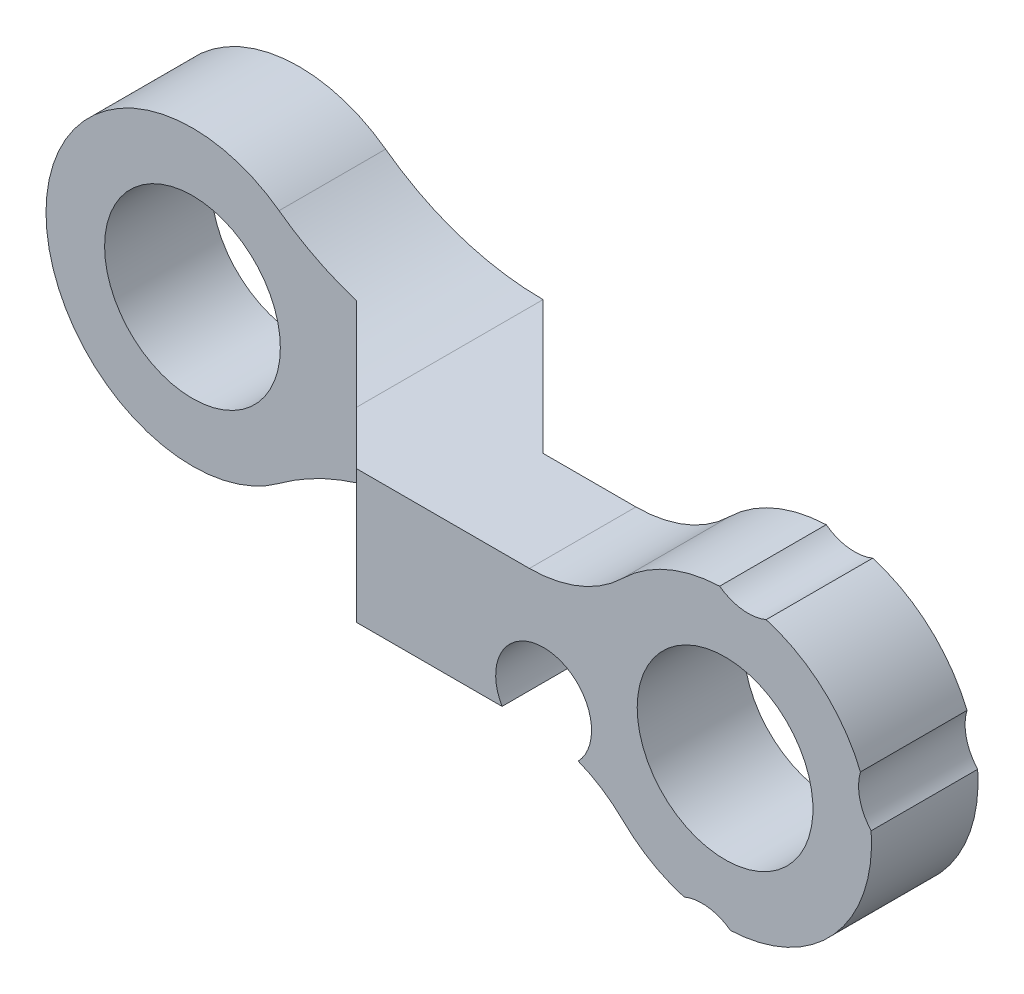
from build123d import *

# Parameters (mm, degrees)
SKETCH_1_R          = 2
EXTRUDE_1_DEPTH     = 4
FILLET_1_R          = 10
FILLET_2_R          = 2
SKETCH_8_R          = 3.300000000000001
EXTRUDE_3_DEPTH     = 5
CHAMFER_1_SIZE      = 5
SKETCH_9_R          = 3.300000000000001
CUT_EXTRUDE_3_DEPTH = 5
CHAMFER_2_SIZE      = 5
SKETCH_10_R         = 5.5
SKETCH_10_R_2       = 3.3000000000000003
EXTRUDE_4_DEPTH     = 4
SKETCH_11_R         = 3.3000000000000007
CUT_EXTRUDE_4_DEPTH = 4
FILLET_3_R          = 5
SKETCH_12_R         = 1.7999999999999998
SKETCH_12_R_2       = 1.800000000000001
SKETCH_12_R_3       = 1.7999999999999972
SKETCH_12_R_4       = 1.8000000000000007
CUT_EXTRUDE_5_DEPTH = 10


with BuildPart() as part:
    # ｽｹｯﾁ1 → ﾎﾞｽ - 押し出し1 (new body)
    # profile 1 of 5: a face of its own
    with BuildSketch(Plane.XY):
        with BuildLine():
            ThreePointArc((-27.5, 2.1540659228538024), (-27.33345237791561, 2.333452377915602), (-27.15406592285381, 2.49999999999999))
            Line((-27.154065922853814, 2.499999999999997), (-27.499999999999996, 2.499999999999997))
            Line((-27.499999999999996, 2.499999999999997), (-27.499999999999996, 2.154065922853802))
        make_face()
    # profile 2 of 5: a face of its own
    with BuildSketch(Plane.XY):
        with BuildLine():
            Line((-27.5, -2.500000000000003), (-27.154065922853817, -2.500000000000003))
            ThreePointArc((-27.154065922853817, -2.499999999999992), (-27.333452377915613, -2.3334523779156044), (-27.5, -2.1540659228538055))
            Line((-27.5, -2.1540659228538055), (-27.5, -2.500000000000003))
        make_face()
    # profile 3 of 5: a face of its own
    with BuildSketch(Plane.XY):
        with BuildLine():
            ThreePointArc((-20.10102051443362, 2.49999999999994), (-30.499999999999996, -2.39e-15), (-20.101020514433618, -2.4999999999999454))
            Line((-20.1010205144336, -2.500000000000002), (-22.84593407714621, -2.5000000000000027))
            ThreePointArc((-22.845934077146207, -2.5000000000000133), (-25.000000000000018, -3.3000000000000043), (-27.154065922853817, -2.499999999999992))
            Line((-27.154065922853817, -2.500000000000003), (-27.5, -2.500000000000003))
            Line((-27.5, -2.500000000000003), (-27.5, -2.1540659228538055))
            ThreePointArc((-27.5, -2.1540659228538055), (-28.3, -1.19e-15), (-27.5, 2.1540659228538024))
            Line((-27.499999999999996, 2.154065922853802), (-27.499999999999996, 2.499999999999997))
            Line((-27.499999999999996, 2.499999999999997), (-27.154065922853814, 2.499999999999997))
            ThreePointArc((-27.15406592285381, 2.49999999999999), (-25.000000000000014, 3.299999999999998), (-22.845934077146207, 2.500000000000007))
            Line((-22.84593407714621, 2.4999999999999982), (-20.1010205144336, 2.4999999999999987))
        make_face()
    # profile 4 of 5: a face of its own
    with BuildSketch(Plane.XY):
        with BuildLine():
            Line((-22.84593407714621, -2.5000000000000027), (-20.1010205144336, -2.500000000000002))
            ThreePointArc((-20.101020514433618, -2.4999999999999454), (-19.652365608485606, -1.2856151891963796), (-19.500000000000004, -4.41e-15))
            ThreePointArc((-19.500000000000004, -3.06e-15), (-19.652365608485606, 1.2856151891963756), (-20.10102051443362, 2.49999999999994))
            Line((-20.1010205144336, 2.4999999999999987), (-22.84593407714621, 2.4999999999999982))
            ThreePointArc((-22.845934077146207, 2.5000000000000067), (-22.00013187411367, 1.3750604449591433), (-21.7, -3.06e-15))
            ThreePointArc((-21.7, -3.87e-15), (-22.00013187411367, -1.3750604449591517), (-22.845934077146207, -2.5000000000000133))
        make_face()
    # profile 5 of 5: a face of its own
    with BuildSketch(Plane.XY):
        with BuildLine():
            Line((-20.1010205144336, -2.500000000000002), (2.5, -2.4999999999999996))
            Line((2.5, -2.4999999999999996), (2.499999999999999, 2.500000000000005))
            Line((2.499999999999999, 2.500000000000005), (-20.1010205144336, 2.4999999999999987))
            ThreePointArc((-20.10102051443362, 2.49999999999994), (-19.652365608485606, 1.2856151891963756), (-19.500000000000004, -3.06e-15))
            ThreePointArc((-19.500000000000004, -4.41e-15), (-19.652365608485606, -1.2856151891963796), (-20.101020514433618, -2.4999999999999454))
        make_face()
        Circle(SKETCH_1_R, mode=Mode.SUBTRACT)
    extrude(amount=EXTRUDE_1_DEPTH)

    # ﾌｨﾚｯﾄ1
    fillet_1_edges = [part.edges().sort_by_distance(p)[0] for p in [
        (-20.10102051443361, 2.4999999999999694, 2),
        (-20.10102051443361, -2.4999999999999742, 2),
    ]]
    fillet(fillet_1_edges, radius=FILLET_1_R)

    # ﾌｨﾚｯﾄ2
    fillet_2_edges = [part.edges().sort_by_distance(p)[0] for p in [
        (2.499999999999999, 2.500000000000005, 2),
        (2.5, -2.4999999999999996, 2),
    ]]
    fillet(fillet_2_edges, radius=FILLET_2_R)

    # ｽｹｯﾁ8 → ﾎﾞｽ - 押し出し3 (add)
    with BuildSketch(Plane(origin=(0, 0, 0), x_dir=(-1, 0, 0), z_dir=(0, 0, -1))):
        with BuildLine():
            Line((15.83484861008833, 2.5), (15.834848610088294, -2.500000000000004))
            ThreePointArc((15.834848610088294, -2.500000000000004), (18.945703694279587, -2.996180733770167), (21.747849506805537, -4.435483870967743))
            ThreePointArc((21.747849506805537, -4.435483870967743), (30.499999999999996, -3.06e-15), (21.747849506805537, 4.435483870967737))
            ThreePointArc((21.747849506805537, 4.435483870967737), (18.9457036942796, 2.996180733770169), (15.83484861008833, 2.5))
        make_face()
        with Locations((25, -3.06e-15)):
            Circle(SKETCH_8_R, mode=Mode.SUBTRACT)
    extrude(amount=EXTRUDE_3_DEPTH)

    # 面取り1
    chamfer_1_edges = [part.edges().sort_by_distance(p)[0] for p in [
        (-15.834848610088311, -1.78e-15, 0),
    ]]
    chamfer(chamfer_1_edges, length=CHAMFER_1_SIZE - 0.0001)  # a hair under: the kernel refuses the full size

    # ｽｹｯﾁ9 → ｶｯﾄ - 押し出し3 (cut)
    with BuildSketch(Plane.XY.offset(4)):
        with BuildLine():
            Line((-18.834848610088333, -2.960607985830548), (-18.83484861008833, 2.9606079858305425))
            ThreePointArc((-18.83484861008833, 2.9606079858305425), (-20.351950663989726, 3.5783527846792875), (-21.747849506805537, 4.435483870967737))
            ThreePointArc((-21.747849506805537, 4.435483870967737), (-30.499999999999996, -1.29e-15), (-21.747849506805537, -4.435483870967743))
            ThreePointArc((-21.747849506805537, -4.435483870967743), (-20.35195066398973, -3.5783527846792946), (-18.834848610088333, -2.960607985830548))
        make_face()
        with Locations(Location((-25, -3.06e-15, 0), (0, 0, 180))):
            Circle(SKETCH_9_R, mode=Mode.SUBTRACT)
    extrude(amount=-CUT_EXTRUDE_3_DEPTH, mode=Mode.SUBTRACT)

    # 面取り2
    chamfer_2_edges = [part.edges().sort_by_distance(p)[0] for p in [
        (-18.83484861008833, -2.66e-15, 4),
    ]]
    chamfer(chamfer_2_edges, length=CHAMFER_2_SIZE - 0.0001)  # a hair under: the kernel refuses the full size

    # ｽｹｯﾁ10 → ﾎﾞｽ - 押し出し4 (add)
    with BuildSketch(Plane(origin=(0, 0, 0), x_dir=(-1, 0, 0), z_dir=(0, 0, -1))):
        Circle(SKETCH_10_R)
        Circle(SKETCH_10_R_2, mode=Mode.SUBTRACT)
    extrude(amount=-EXTRUDE_4_DEPTH)

    # ｽｹｯﾁ11 → ｶｯﾄ - 押し出し4 (cut)
    with BuildSketch(Plane(origin=(0, 0, 0), x_dir=(-1, 0, 0), z_dir=(0, 0, -1))):
        Circle(SKETCH_11_R)
    extrude(amount=-CUT_EXTRUDE_4_DEPTH, mode=Mode.SUBTRACT)

    # ﾌｨﾚｯﾄ3
    fillet_3_edges = [part.edges().sort_by_distance(p)[0] for p in [
        (-4.898979485566355, 2.5000000000000027, 2),
        (-4.898979485566356, -2.5000000000000004, 2),
    ]]
    fillet(fillet_3_edges, radius=FILLET_3_R)

    # ｽｹｯﾁ12 → ｶｯﾄ - 押し出し5 (cut)
    with BuildSketch(Plane.XY.offset(4)):
        with Locations((-6.8141053858085305, -1.6024880002863613)):
            Circle(SKETCH_12_R)
        with Locations((-0.8630886568357895, -6.946587505419047)):
            Circle(SKETCH_12_R_2)
        with Locations((6.814105385815693, 1.6024880002767492)):
            Circle(SKETCH_12_R_3)
        with Locations((0.8630886568356403, 6.946587505418688)):
            Circle(SKETCH_12_R_4)
    extrude(amount=-CUT_EXTRUDE_5_DEPTH, mode=Mode.SUBTRACT)


solid = part.part
